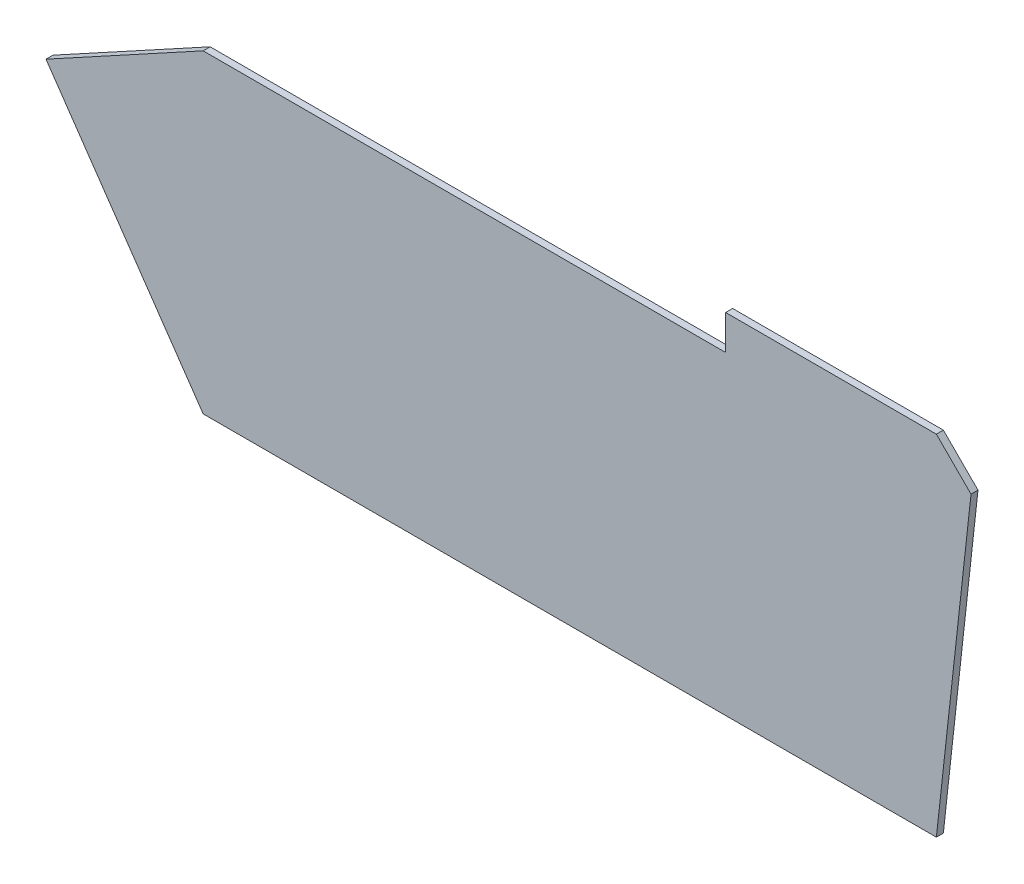
from build123d import *

# Parameters (mm, degrees)
BOSS_EXTRUDE1_DEPTH = 2


with BuildPart() as part:
    # Sketch1 → Boss-Extrude1 (new body)
    with BuildSketch(Plane.XY):
        Polygon((192.039285274, 88.983833718), (201.963048499, 79.060070494), (192.039285274, -11.016166282), (-18.008037477, -11.016166282), (-63.036951501, 54.472600305), (-18.008037477, 79.060070494), (131.67120814, 79.060070494), (131.67120814, 88.983833718), align=None)
    extrude(amount=BOSS_EXTRUDE1_DEPTH)


solid = part.part
